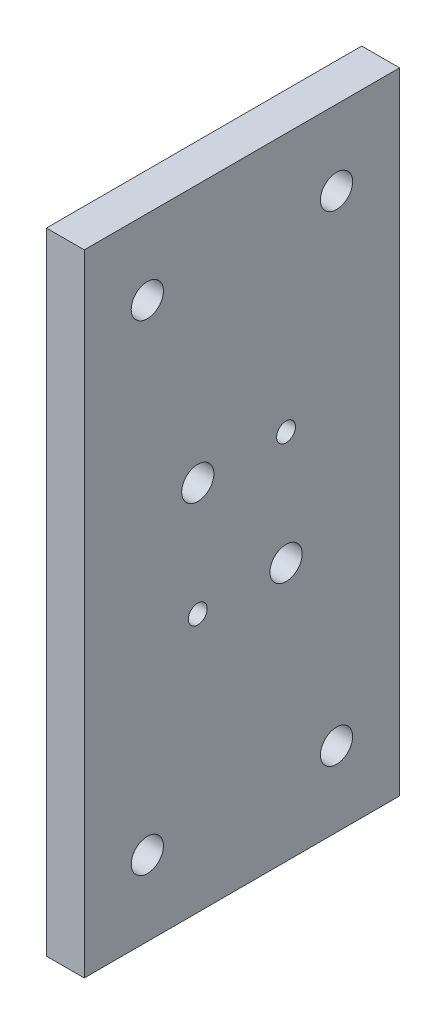
from build123d import *

# Parameters (mm, degrees)
SKETCH1_W           = 100
SKETCH1_H           = 50
SKETCH1_R           = 1.5
SKETCH1_R_2         = 2.555
BOSS_EXTRUDE1_DEPTH = 6


with BuildPart() as part:
    # Sketch1 → Boss-Extrude1 (new body)
    with BuildSketch(Plane.YZ):
        Rectangle(SKETCH1_W, SKETCH1_H)
        with Locations((-9, 7)):
            Circle(SKETCH1_R, mode=Mode.SUBTRACT)
        with Locations((-9, -7)):
            Circle(SKETCH1_R_2, mode=Mode.SUBTRACT)
        with Locations((9, -7)):
            Circle(SKETCH1_R, mode=Mode.SUBTRACT)
        with Locations((9, 7)):
            Circle(SKETCH1_R_2, mode=Mode.SUBTRACT)
        with Locations((-38.1, 15)):
            Circle(SKETCH1_R_2, mode=Mode.SUBTRACT)
        with Locations((-38.1, -15)):
            Circle(SKETCH1_R_2, mode=Mode.SUBTRACT)
        with Locations((38.1, 15)):
            Circle(SKETCH1_R_2, mode=Mode.SUBTRACT)
        with Locations((38.1, -15)):
            Circle(SKETCH1_R_2, mode=Mode.SUBTRACT)
    extrude(amount=BOSS_EXTRUDE1_DEPTH)


solid = part.part
